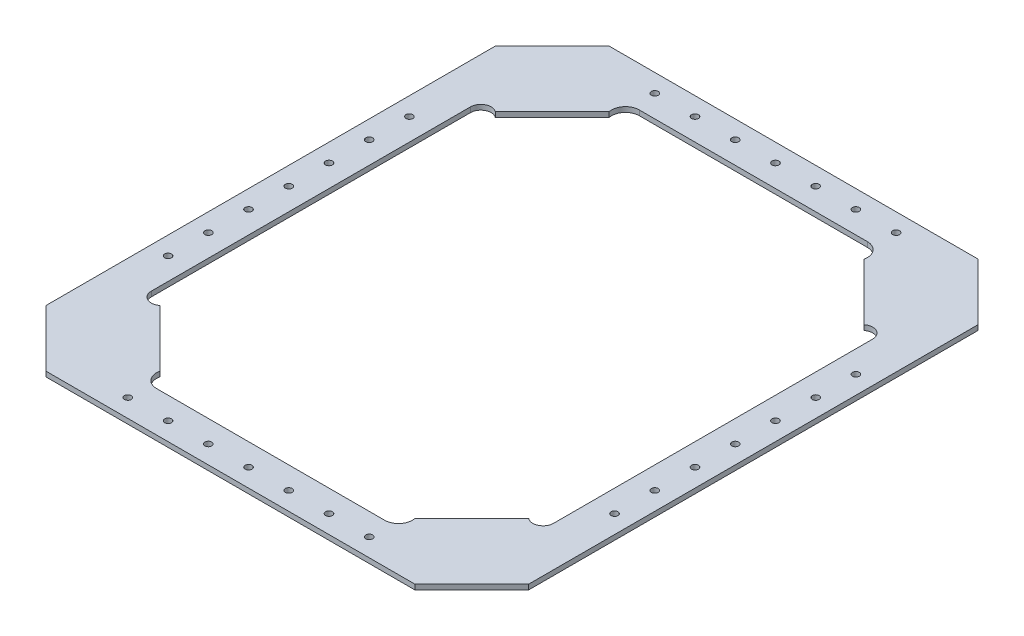
from build123d import *

# Parameters (mm, degrees)
BOSS_EXTRUDE1_DEPTH = 3.175
CUT_EXTRUDE1_DEPTH  = 252.960239461
BOSS_EXTRUDE2_DEPTH = 3.175
SKETCH4_R           = 2.159
CUT_EXTRUDE2_DEPTH  = 252.960239461
SKETCH6_W           = 254
SKETCH6_H           = 106.880400145
CUT_EXTRUDE3_DEPTH  = 252.960239461


with BuildPart() as part:
    # Sketch1 → Boss-Extrude1 (new body)
    with BuildSketch(Plane(origin=(0, 0, 0), x_dir=(1, 0, 0), z_dir=(0, 1, 0))):
        Polygon((-152.4, 119.059630377), (-116.478975516, 154.980654861), (116.478975516, 154.980654861), (152.4, 119.059630377), (152.4, -164.698320655), (116.478975516, -200.619345139), (-116.478975516, -200.619345139), (-152.4, -164.698320655), align=None)
    extrude(amount=BOSS_EXTRUDE1_DEPTH)

    # Sketch2 → Cut-Extrude1 (cut, through all)
    with BuildSketch(Plane(origin=(0, 3.175, 0), x_dir=(1, 0, 0), z_dir=(0, 1, 0))):
        Polygon((-91.078975516, 129.580654861), (91.078975516, 129.580654861), (127, 93.659630377), (127, 8.930654861), (82.442975516, 8.930654861), (-74.314975516, 8.930654861), (-127, 8.930654861), (-127, 93.659630377), align=None)
        Polygon((127, -139.298320655), (91.078975516, -175.219345139), (-91.078975516, -175.219345139), (-127, -139.298320655), (-127, -54.569345139), (-74.314975516, -54.569345139), (82.442975516, -54.569345139), (127, -54.569345139), align=None)
    extrude(amount=-CUT_EXTRUDE1_DEPTH, mode=Mode.SUBTRACT)

    # Sketch5 → Boss-Extrude2 (add)
    with BuildSketch(Plane(origin=(0, 3.175, 0), x_dir=(1, 0, 0), z_dir=(0, 1, 0))):
        with BuildLine():
            Line((-116.478975516, 83.138605892), (-80.557951031, 119.059630377))
            ThreePointArc((-80.557951031, 119.059630377), (-78.800891411, 126.352814743), (-72.028975516, 129.580654861))
            Line((-72.028975516, 129.580654861), (-59.328975516, 129.580654861))
            Line((-59.328975516, 129.580654861), (-59.328975516, 154.980654861))
            Line((-59.328975516, 154.980654861), (-116.478975516, 154.980654861))
            Line((-116.478975516, 154.980654861), (-152.4, 119.059630377))
            Line((-152.4, 119.059630377), (-152.4, 65.258187686))
            Line((-152.4, 65.258187686), (-127, 65.258187686))
            Line((-127, 65.258187686), (-127, 77.958187686))
            ThreePointArc((-127, 77.958187686), (-123.351279088, 83.821819005), (-116.478975516, 83.138605892))
        make_face()
        with BuildLine():
            Line((127, 65.258187686), (127, 77.958187686))
            ThreePointArc((127, 77.958187686), (123.351279088, 83.821819005), (116.478975516, 83.138605892))
            Line((116.478975516, 83.138605892), (80.557951031, 119.059630377))
            ThreePointArc((80.557951031, 119.059630377), (78.800891411, 126.352814743), (72.028975516, 129.580654861))
            Line((72.028975516, 129.580654861), (59.328975516, 129.580654861))
            Line((59.328975516, 129.580654861), (59.328975516, 154.980654861))
            Line((59.328975516, 154.980654861), (116.478975516, 154.980654861))
            Line((116.478975516, 154.980654861), (152.4, 119.059630377))
            Line((152.4, 119.059630377), (152.4, 65.258187686))
            Line((152.4, 65.258187686), (127, 65.258187686))
        make_face()
        with BuildLine():
            Line((116.478975516, -128.777296171), (80.557951031, -164.698320655))
            ThreePointArc((80.557951031, -164.698320655), (78.800891411, -171.991505021), (72.028975516, -175.219345139))
            Line((72.028975516, -175.219345139), (59.328975516, -175.219345139))
            Line((59.328975516, -175.219345139), (59.328975516, -200.619345139))
            Line((59.328975516, -200.619345139), (116.478975516, -200.619345139))
            Line((116.478975516, -200.619345139), (152.4, -164.698320655))
            Line((152.4, -164.698320655), (152.4, -110.896877964))
            Line((152.4, -110.896877964), (127, -110.896877964))
            Line((127, -110.896877964), (127, -123.596877964))
            ThreePointArc((127, -123.596877964), (123.351279088, -129.460509283), (116.478975516, -128.777296171))
        make_face()
        with BuildLine():
            Line((-127, -110.896877964), (-127, -123.596877964))
            ThreePointArc((-127, -123.596877964), (-123.351279088, -129.460509283), (-116.478975516, -128.777296171))
            Line((-116.478975516, -128.777296171), (-80.557951031, -164.698320655))
            ThreePointArc((-80.557951031, -164.698320655), (-78.800891411, -171.991505021), (-72.028975516, -175.219345139))
            Line((-72.028975516, -175.219345139), (-59.328975516, -175.219345139))
            Line((-59.328975516, -175.219345139), (-59.328975516, -200.619345139))
            Line((-59.328975516, -200.619345139), (-116.478975516, -200.619345139))
            Line((-116.478975516, -200.619345139), (-152.4, -164.698320655))
            Line((-152.4, -164.698320655), (-152.4, -110.896877964))
            Line((-152.4, -110.896877964), (-127, -110.896877964))
        make_face()
    extrude(amount=-BOSS_EXTRUDE2_DEPTH)

    # Sketch4 → Cut-Extrude2 (cut, through all)
    with BuildSketch(Plane(origin=(0, 3.175, 0), x_dir=(1, 0, 0), z_dir=(0, 1, 0))):
        with Locations((0, 143.550654861)):
            Circle(SKETCH4_R)
        with Locations((-50.8, 143.550654861)):
            Circle(SKETCH4_R)
        with Locations((50.8, 143.550654861)):
            Circle(SKETCH4_R)
        with Locations((-25.4, 143.550654861)):
            Circle(SKETCH4_R)
        with Locations((25.4, 143.550654861)):
            Circle(SKETCH4_R)
        with Locations((-140.97, -22.819345139)):
            Circle(SKETCH4_R)
        with Locations((-140.97, 2.580654861)):
            Circle(SKETCH4_R)
        with Locations((-140.97, 27.980654861)):
            Circle(SKETCH4_R)
        with Locations((140.97, -22.819345139)):
            Circle(SKETCH4_R)
        with Locations((140.97, 2.580654861)):
            Circle(SKETCH4_R)
        with Locations((140.97, 27.980654861)):
            Circle(SKETCH4_R)
        with Locations((140.97, -73.619345139)):
            Circle(SKETCH4_R)
        with Locations((140.97, -48.219345139)):
            Circle(SKETCH4_R)
        with Locations((-140.97, -73.619345139)):
            Circle(SKETCH4_R)
        with Locations((-140.97, -48.219345139)):
            Circle(SKETCH4_R)
        with Locations((25.4, -189.189345139)):
            Circle(SKETCH4_R)
        with Locations((-25.4, -189.189345139)):
            Circle(SKETCH4_R)
        with Locations((50.8, -189.189345139)):
            Circle(SKETCH4_R)
        with Locations((-50.8, -189.189345139)):
            Circle(SKETCH4_R)
        with Locations((0, -189.189345139)):
            Circle(SKETCH4_R)
        with Locations((-76.2, 143.550654861)):
            Circle(SKETCH4_R)
        with Locations((76.2, 143.550654861)):
            Circle(SKETCH4_R)
        with Locations((-140.97, 53.380654861)):
            Circle(SKETCH4_R)
        with Locations((140.97, 53.380654861)):
            Circle(SKETCH4_R)
        with Locations((140.97, -99.019345139)):
            Circle(SKETCH4_R)
        with Locations((76.2, -189.189345139)):
            Circle(SKETCH4_R)
        with Locations((-76.2, -189.189345139)):
            Circle(SKETCH4_R)
        with Locations((-140.97, -99.019345139)):
            Circle(SKETCH4_R)
    extrude(amount=-CUT_EXTRUDE2_DEPTH, mode=Mode.SUBTRACT)

    # Sketch6 → Cut-Extrude3 (cut, through all)
    with BuildSketch(Plane(origin=(0, 3.175, 0), x_dir=(1, 0, 0), z_dir=(0, 1, 0))):
        with Locations((0, -26.175268273)):
            Rectangle(SKETCH6_W, SKETCH6_H)
    extrude(amount=-CUT_EXTRUDE3_DEPTH, mode=Mode.SUBTRACT)


solid = part.part
